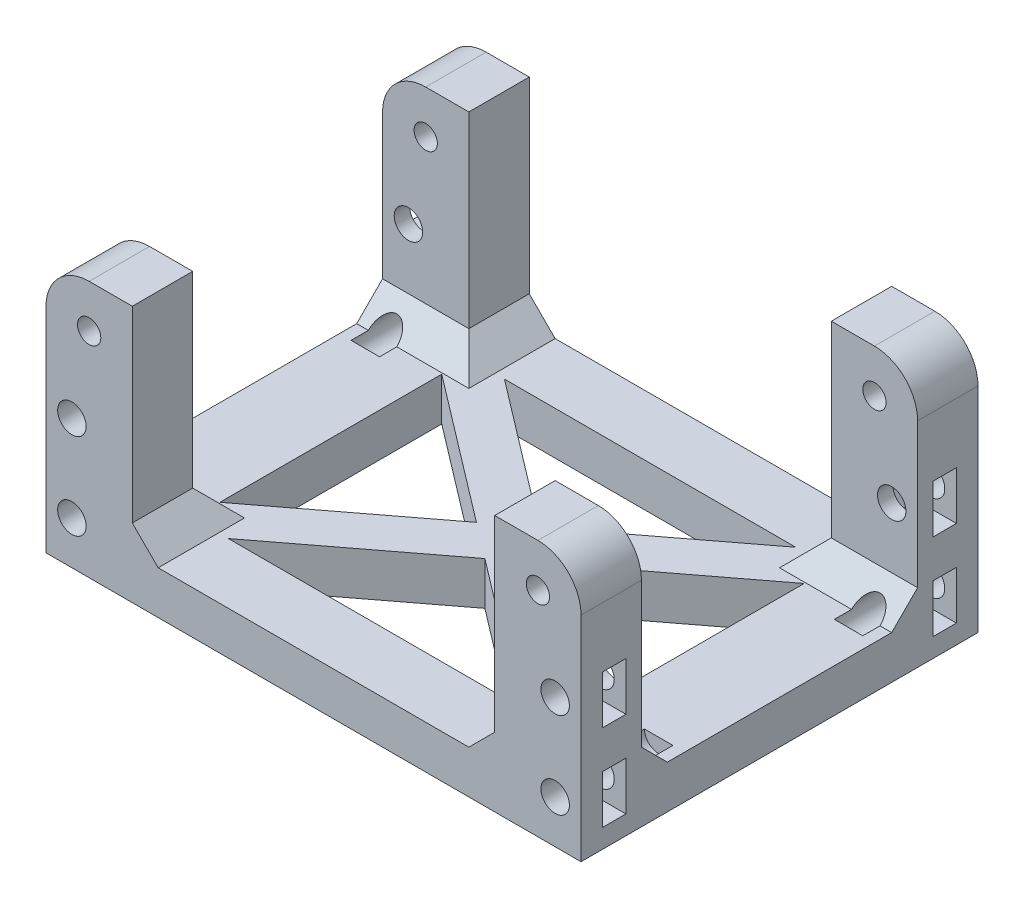
from build123d import *

# Parameters (mm, degrees)
SKETCH_1_W          = 62
SKETCH_1_H          = 46
EXTRUDE_1_DEPTH     = 5
SKETCH_2_W          = 10
SKETCH_2_H          = 15
EXTRUDE_2_DEPTH     = 7
SKETCH_3_R          = 1.65
CUT_EXTRUDE_1_DEPTH = 12
SKETCH_7_W          = 10
SKETCH_7_H          = 7
EXTRUDE_4_DEPTH     = 9.75
CUT_EXTRUDE_4_REACH = 64.945
SKETCH_8_R          = 1.35
CUT_EXTRUDE_2_DEPTH = 2.7
CUT_EXTRUDE_3_REACH = 50.735
SKETCH_5_W          = 42
SKETCH_5_H          = 32
EXTRUDE_3_DEPTH     = 5
CHAMFER_4_SIZE      = 3
FILLET_1_R          = 5


with BuildPart() as part:
    # 草图1 → 凸台-拉伸1 (new body)
    with BuildSketch(Plane(origin=(0, 0, 0), x_dir=(1, 0, 0), z_dir=(0, 1, 0))):
        Rectangle(SKETCH_1_W, SKETCH_1_H)
    extrude(amount=EXTRUDE_1_DEPTH)

    # 草图2 → 凸台-拉伸2 (add)
    with BuildSketch(Plane.XY.offset(23)):
        with Locations((-26, 12.5)):
            Rectangle(SKETCH_2_W, SKETCH_2_H)
        with Locations((26, 12.5)):
            Rectangle(SKETCH_2_W, SKETCH_2_H)
    extrude_2 = extrude(amount=-EXTRUDE_2_DEPTH)

    # 草图3 → 切除-拉伸1 (cut)
    with BuildSketch(Plane.XY.offset(23)):
        with Locations((-28, 15)):
            Circle(SKETCH_3_R)
        with Locations((-28, 5)):
            Circle(SKETCH_3_R)
        with Locations((28, 5)):
            Circle(SKETCH_3_R)
        with Locations((28, 15)):
            Circle(SKETCH_3_R)
    cut_extrude_1 = extrude(amount=-CUT_EXTRUDE_1_DEPTH, mode=Mode.SUBTRACT)

    # 草图7 → 凸台-拉伸4 (add)
    with BuildSketch(Plane(origin=(0, 20, 0), x_dir=(1, 0, 0), z_dir=(0, 1, 0))):
        with Locations((-26, -19.5)):
            Rectangle(SKETCH_7_W, SKETCH_7_H)
        with Locations((26, -19.5)):
            Rectangle(SKETCH_7_W, SKETCH_7_H)
    extrude_4 = extrude(amount=EXTRUDE_4_DEPTH)

    # 草图8 → 切除-拉伸4 (cut, up to next)
    with BuildSketch(Plane.XY.offset(23), mode=Mode.PRIVATE) as cut_extrude_4_sk1:
        with Locations((-26, 24.75)):
            Circle(SKETCH_8_R)
    cut_extrude_4_tool1 = extrude(cut_extrude_4_sk1.sketch, amount=-CUT_EXTRUDE_4_REACH, mode=Mode.PRIVATE) & part.part
    # 草图8 → 切除-拉伸4 (cut, up to next)
    with BuildSketch(Plane.XY.offset(23), mode=Mode.PRIVATE) as cut_extrude_4_sk2:
        with Locations((26, 24.75)):
            Circle(SKETCH_8_R)
    cut_extrude_4_tool2 = extrude(cut_extrude_4_sk2.sketch, amount=-CUT_EXTRUDE_4_REACH, mode=Mode.PRIVATE) & part.part
    cut_extrude_4_1 = cut_extrude_4_tool1.solids().sort_by_distance((-26, 24.75, 23))[0]
    add(cut_extrude_4_1, mode=Mode.SUBTRACT)
    cut_extrude_4_2 = cut_extrude_4_tool2.solids().sort_by_distance((26, 24.75, 23))[0]
    add(cut_extrude_4_2, mode=Mode.SUBTRACT)
    cut_extrude_4 = cut_extrude_4_1 + cut_extrude_4_2  # 切除-拉伸4 as one shape, for the pattern or mirror that repeats it

    # 草图4 → 切除-拉伸2 (cut)
    with BuildSketch(Plane.XY.offset(20.5)):
        Polygon((-29.616580754, 17.8), (-31.233161507, 17.8), (-31.233161507, 15), (-31.233161507, 12.2), (-29.616580754, 12.2), (-26.383419246, 12.2), (-24.766838493, 15), (-26.383419246, 17.8), align=None)
        Polygon((-24.766838493, 5), (-26.383419246, 7.8), (-29.616580754, 7.8), (-31.233161507, 7.8), (-31.233161507, 5), (-31.233161507, 2.2), (-29.616580754, 2.2), (-26.383419246, 2.2), align=None)
        Polygon((24.766838493, 15), (26.383419246, 12.2), (29.616580754, 12.2), (31.233161507, 12.2), (31.233161507, 15), (31.233161507, 17.8), (29.616580754, 17.8), (26.383419246, 17.8), align=None)
        Polygon((24.766838493, 5), (26.383419246, 2.2), (29.616580754, 2.2), (31.233161507, 2.2), (31.233161507, 5), (31.233161507, 7.8), (29.616580754, 7.8), (26.383419246, 7.8), align=None)
    cut_extrude_2 = extrude(amount=-CUT_EXTRUDE_2_DEPTH, mode=Mode.SUBTRACT)

    # 镜向1: 凸台-拉伸2, 切除-拉伸1, 凸台-拉伸4, 切除-拉伸4, 切除-拉伸2 across plane
    add(extrude_2.mirror(Plane.XY))
    add(cut_extrude_1.mirror(Plane.XY), mode=Mode.SUBTRACT)
    add(extrude_4.mirror(Plane.XY))
    add(cut_extrude_4.mirror(Plane.XY), mode=Mode.SUBTRACT)
    add(cut_extrude_2.mirror(Plane.XY), mode=Mode.SUBTRACT)

    # 草图5 → 切除-拉伸3 (cut, up to next)
    with BuildSketch(Plane(origin=(0, 29.75, 0), x_dir=(1, 0, 0), z_dir=(0, 1, 0)), mode=Mode.PRIVATE) as cut_extrude_3_sk1:
        Rectangle(SKETCH_5_W, SKETCH_5_H)
    cut_extrude_3_tool1 = extrude(cut_extrude_3_sk1.sketch, amount=-CUT_EXTRUDE_3_REACH, mode=Mode.PRIVATE) & part.part
    add(cut_extrude_3_tool1.solids().sort_by_distance((0, 29.75, 0))[0], mode=Mode.SUBTRACT)

    # 草图6 → 凸台-拉伸3 (add)
    with BuildSketch(Plane(origin=(0, 0, 0), x_dir=(1, 0, 0), z_dir=(0, 1, 0))):
        Polygon((-22.515108038, 14.0114207), (-4.12511837, 0), (0, 3.142947329), (-19.484891962, 17.9885793), align=None)
        Polygon((0, 3.142947329), (4.12511837, 0), (22.515108038, 14.0114207), (19.484891962, 17.9885793), align=None)
        Polygon((-4.12511837, 0), (0, -3.142947329), (4.12511837, 0), (0, 3.142947329), align=None)
        Polygon((-19.484891962, -17.9885793), (0, -3.142947329), (-4.12511837, 0), (-22.515108038, -14.0114207), align=None)
        Polygon((0, -3.142947329), (19.484891962, -17.9885793), (22.515108038, -14.0114207), (4.12511837, 0), align=None)
    extrude(amount=EXTRUDE_3_DEPTH)

    # 倒角4
    # the kernel refuses this chamfer: 3 mm, written as the material it adds along each edge
    with BuildSketch(Plane(origin=(-21, 5, 23), x_dir=(-0.02749587661058678, 0.9996219169112968, 0), z_dir=(0, 0, -1)), Plane(origin=(21, 5, 23), x_dir=(-0.9996219169112968, -0.02749587661058619, 0), z_dir=(0, 0, -1)), Plane(origin=(-21, 5, -23), x_dir=(0.9996219169112968, -0.02749587661058648, 0), z_dir=(0, 0, 1))) as chamfer_4_piece_1:
        Polygon((CHAMFER_4_SIZE * 0.999621916911, CHAMFER_4_SIZE * 0.0274958766106), (-CHAMFER_4_SIZE * 0.0274958766106, CHAMFER_4_SIZE * 0.999621916911), (0, 0), align=None)
    extrude(amount=7)
    with BuildSketch(Plane(origin=(34.065048964, 5, -16), x_dir=(0, -0.027495876610586494, 0.9996219169112968), z_dir=(-1, 0, 0))) as chamfer_4_piece_2_section:
        Polygon((CHAMFER_4_SIZE * 0.999621916911, CHAMFER_4_SIZE * 0.0274958766106), (-CHAMFER_4_SIZE * 0.0274958766106, CHAMFER_4_SIZE * 0.999621916911), (0, 0), align=None)
    chamfer_4_piece_2 = extrude(amount=13.065048964, mode=Mode.PRIVATE)
    chamfer_4_piece_2 = split(chamfer_4_piece_2, bisect_by=Plane(origin=(31, 6.10549046, -15.071672934), z_dir=(-1, 0, 0)), keep=Keep.TOP, mode=Mode.PRIVATE)
    chamfer_4_piece_2 = chamfer_4_piece_2 - Plane(origin=(28, 5, -15.071672934), x_dir=(1, 0, 0), z_dir=(0, 0, -1)) * Cylinder(1.65, 39, mode=Mode.PRIVATE)
    add(chamfer_4_piece_2)
    with BuildSketch(Plane(origin=(21, 5, -23), x_dir=(-0.9996219169112968, -0.02749587661058619, 0), z_dir=(0, 0, 1))) as chamfer_4_piece_3:
        Polygon((CHAMFER_4_SIZE * 0.999621916911, -CHAMFER_4_SIZE * 0.0274958766106), (-CHAMFER_4_SIZE * 0.0274958766106, -CHAMFER_4_SIZE * 0.999621916911), (0, 0), align=None)
    extrude(amount=7)
    with BuildSketch(Plane(origin=(-34.065048964, 5, -16), x_dir=(0, -0.027495876610586494, 0.9996219169112968), z_dir=(1, 0, 0))) as chamfer_4_piece_4_section:
        Polygon((CHAMFER_4_SIZE * 0.999621916911, -CHAMFER_4_SIZE * 0.0274958766106), (-CHAMFER_4_SIZE * 0.0274958766106, -CHAMFER_4_SIZE * 0.999621916911), (0, 0), align=None)
    chamfer_4_piece_4 = extrude(amount=13.065048964, mode=Mode.PRIVATE)
    chamfer_4_piece_4 = split(chamfer_4_piece_4, bisect_by=Plane(origin=(-31, 6.105490461, -15.071672933), z_dir=(1, 0, 0)), keep=Keep.TOP, mode=Mode.PRIVATE)
    chamfer_4_piece_4 = chamfer_4_piece_4 - Plane(origin=(-28, 5, -15.071672933), x_dir=(1, 0, 0), z_dir=(0, 0, -1)) * Cylinder(1.65, 39, mode=Mode.PRIVATE)
    add(chamfer_4_piece_4)
    with BuildSketch(Plane(origin=(-34.065048964, 5, 16), x_dir=(0, -0.027495876610586494, -0.9996219169112968), z_dir=(1, 0, 0))) as chamfer_4_piece_5_section:
        Polygon((CHAMFER_4_SIZE * 0.999621916911, CHAMFER_4_SIZE * 0.0274958766106), (-CHAMFER_4_SIZE * 0.0274958766106, CHAMFER_4_SIZE * 0.999621916911), (0, 0), align=None)
    chamfer_4_piece_5 = extrude(amount=13.065048964, mode=Mode.PRIVATE)
    chamfer_4_piece_5 = split(chamfer_4_piece_5, bisect_by=Plane(origin=(-31, 6.105490461, 15.071672933), z_dir=(1, 0, 0)), keep=Keep.TOP, mode=Mode.PRIVATE)
    chamfer_4_piece_5 = chamfer_4_piece_5 - Plane(origin=(-28, 5, 15.071672933), x_dir=(1, 0, 0), z_dir=(0, 0, 1)) * Cylinder(1.65, 39, mode=Mode.PRIVATE)
    add(chamfer_4_piece_5)
    with BuildSketch(Plane(origin=(34.065048964, 5, 16), x_dir=(0, -0.027495876610586494, -0.9996219169112968), z_dir=(-1, 0, 0))) as chamfer_4_piece_6_section:
        Polygon((CHAMFER_4_SIZE * 0.999621916911, -CHAMFER_4_SIZE * 0.0274958766106), (-CHAMFER_4_SIZE * 0.0274958766106, -CHAMFER_4_SIZE * 0.999621916911), (0, 0), align=None)
    chamfer_4_piece_6 = extrude(amount=13.065048964, mode=Mode.PRIVATE)
    chamfer_4_piece_6 = split(chamfer_4_piece_6, bisect_by=Plane(origin=(31, 6.10549046, 15.071672934), z_dir=(-1, 0, 0)), keep=Keep.TOP, mode=Mode.PRIVATE)
    chamfer_4_piece_6 = chamfer_4_piece_6 - Plane(origin=(28, 5, 15.071672934), x_dir=(1, 0, 0), z_dir=(0, 0, 1)) * Cylinder(1.65, 39, mode=Mode.PRIVATE)
    add(chamfer_4_piece_6)
    with BuildSketch(Plane(origin=(-21, 5, 23), x_dir=(-0.02749587661058678, 0.9996219169112968, 0), z_dir=(0, 0, -1))) as chamfer_4_piece_7a_section:
        Polygon((CHAMFER_4_SIZE * 0.999621916911, CHAMFER_4_SIZE * 0.0274958766106), (-CHAMFER_4_SIZE * 0.0274958766106, CHAMFER_4_SIZE * 0.999621916911), (0, 0), align=None)
    chamfer_4_piece_7a = extrude(amount=14.715048964, mode=Mode.PRIVATE)
    chamfer_4_piece_7a = split(chamfer_4_piece_7a, bisect_by=Plane(origin=(-19.8988735, 5.929641192, 16), z_dir=(0, 0, -1)), keep=Keep.TOP, mode=Mode.PRIVATE)
    chamfer_4_piece_7a = split(chamfer_4_piece_7a, bisect_by=Plane(origin=(-20.858643002, 5.929641192, 12.749352101), z_dir=(0.6060432152628566, 0, 0.7954317200324984)), keep=Keep.TOP, mode=Mode.PRIVATE)
    with BuildSketch(Plane(origin=(-34.065048964, 5, 16), x_dir=(0, -0.027495876610586494, -0.9996219169112968), z_dir=(1, 0, 0))) as chamfer_4_piece_7b_section:
        Polygon((CHAMFER_4_SIZE * 0.999621916911, CHAMFER_4_SIZE * 0.0274958766106), (-CHAMFER_4_SIZE * 0.0274958766106, CHAMFER_4_SIZE * 0.999621916911), (0, 0), align=None)
    chamfer_4_piece_7b = extrude(amount=20.780097928, mode=Mode.PRIVATE)
    chamfer_4_piece_7b = split(chamfer_4_piece_7b, bisect_by=Plane(origin=(-21, 5.915915897, 14.873215442), z_dir=(1, 0, 0)), keep=Keep.TOP, mode=Mode.PRIVATE)
    chamfer_4_piece_7b = split(chamfer_4_piece_7b, bisect_by=Plane(origin=(-17.170062576, 5.915915897, 16.224899768), z_dir=(-0.6060432152628568, 0, -0.7954317200324983)), keep=Keep.TOP, mode=Mode.PRIVATE)
    chamfer_4_piece_7 = chamfer_4_piece_7a & chamfer_4_piece_7b
    add(chamfer_4_piece_7)
    with BuildSketch(Plane(origin=(21, 5, 23), x_dir=(-0.9996219169112968, -0.02749587661058619, 0), z_dir=(0, 0, -1))) as chamfer_4_piece_8a_section:
        Polygon((CHAMFER_4_SIZE * 0.999621916911, CHAMFER_4_SIZE * 0.0274958766106), (-CHAMFER_4_SIZE * 0.0274958766106, CHAMFER_4_SIZE * 0.999621916911), (0, 0), align=None)
    chamfer_4_piece_8a = extrude(amount=14.715048964, mode=Mode.PRIVATE)
    chamfer_4_piece_8a = split(chamfer_4_piece_8a, bisect_by=Plane(origin=(20.858643002, 5.929641192, 12.749352101), z_dir=(-0.6060432152628565, 0, 0.7954317200324984)), keep=Keep.TOP, mode=Mode.PRIVATE)
    chamfer_4_piece_8a = split(chamfer_4_piece_8a, bisect_by=Plane(origin=(19.8988735, 5.929641192, 16), z_dir=(0, 0, -1)), keep=Keep.TOP, mode=Mode.PRIVATE)
    with BuildSketch(Plane(origin=(34.065048964, 5, 16), x_dir=(0, -0.027495876610586494, -0.9996219169112968), z_dir=(-1, 0, 0))) as chamfer_4_piece_8b_section:
        Polygon((CHAMFER_4_SIZE * 0.999621916911, -CHAMFER_4_SIZE * 0.0274958766106), (-CHAMFER_4_SIZE * 0.0274958766106, -CHAMFER_4_SIZE * 0.999621916911), (0, 0), align=None)
    chamfer_4_piece_8b = extrude(amount=20.780097928, mode=Mode.PRIVATE)
    chamfer_4_piece_8b = split(chamfer_4_piece_8b, bisect_by=Plane(origin=(17.170062576, 5.915915897, 16.224899768), z_dir=(0.6060432152628563, 0, -0.7954317200324986)), keep=Keep.TOP, mode=Mode.PRIVATE)
    chamfer_4_piece_8b = split(chamfer_4_piece_8b, bisect_by=Plane(origin=(21, 5.915915897, 14.873215442), z_dir=(-1, 0, 0)), keep=Keep.TOP, mode=Mode.PRIVATE)
    chamfer_4_piece_8 = chamfer_4_piece_8a & chamfer_4_piece_8b
    add(chamfer_4_piece_8)
    with BuildSketch(Plane(origin=(34.065048964, 5, -16), x_dir=(0, -0.027495876610586494, 0.9996219169112968), z_dir=(-1, 0, 0))) as chamfer_4_piece_9a_section:
        Polygon((CHAMFER_4_SIZE * 0.999621916911, CHAMFER_4_SIZE * 0.0274958766106), (-CHAMFER_4_SIZE * 0.0274958766106, CHAMFER_4_SIZE * 0.999621916911), (0, 0), align=None)
    chamfer_4_piece_9a = extrude(amount=20.780097928, mode=Mode.PRIVATE)
    chamfer_4_piece_9a = split(chamfer_4_piece_9a, bisect_by=Plane(origin=(17.170062576, 5.915915897, -16.224899768), z_dir=(0.6060432152628568, 0, 0.7954317200324984)), keep=Keep.TOP, mode=Mode.PRIVATE)
    chamfer_4_piece_9a = split(chamfer_4_piece_9a, bisect_by=Plane(origin=(21, 5.915915897, -14.873215442), z_dir=(-1, 0, 0)), keep=Keep.TOP, mode=Mode.PRIVATE)
    with BuildSketch(Plane(origin=(21, 5, -23), x_dir=(-0.9996219169112968, -0.02749587661058619, 0), z_dir=(0, 0, 1))) as chamfer_4_piece_9b_section:
        Polygon((CHAMFER_4_SIZE * 0.999621916911, -CHAMFER_4_SIZE * 0.0274958766106), (-CHAMFER_4_SIZE * 0.0274958766106, -CHAMFER_4_SIZE * 0.999621916911), (0, 0), align=None)
    chamfer_4_piece_9b = extrude(amount=14.715048964, mode=Mode.PRIVATE)
    chamfer_4_piece_9b = split(chamfer_4_piece_9b, bisect_by=Plane(origin=(20.858643002, 5.929641192, -12.749352101), z_dir=(-0.6060432152628568, 0, -0.7954317200324983)), keep=Keep.TOP, mode=Mode.PRIVATE)
    chamfer_4_piece_9b = split(chamfer_4_piece_9b, bisect_by=Plane(origin=(19.8988735, 5.929641192, -16), z_dir=(0, 0, 1)), keep=Keep.TOP, mode=Mode.PRIVATE)
    chamfer_4_piece_9 = chamfer_4_piece_9a & chamfer_4_piece_9b
    add(chamfer_4_piece_9)
    with BuildSketch(Plane(origin=(-21, 5, -23), x_dir=(0.9996219169112968, -0.02749587661058648, 0), z_dir=(0, 0, 1))) as chamfer_4_piece_10a_section:
        Polygon((CHAMFER_4_SIZE * 0.999621916911, CHAMFER_4_SIZE * 0.0274958766106), (-CHAMFER_4_SIZE * 0.0274958766106, CHAMFER_4_SIZE * 0.999621916911), (0, 0), align=None)
    chamfer_4_piece_10a = extrude(amount=14.715048964, mode=Mode.PRIVATE)
    chamfer_4_piece_10a = split(chamfer_4_piece_10a, bisect_by=Plane(origin=(-20.858643002, 5.929641192, -12.749352101), z_dir=(0.6060432152628563, 0, -0.7954317200324986)), keep=Keep.TOP, mode=Mode.PRIVATE)
    chamfer_4_piece_10a = split(chamfer_4_piece_10a, bisect_by=Plane(origin=(-19.8988735, 5.929641192, -16), z_dir=(0, 0, 1)), keep=Keep.TOP, mode=Mode.PRIVATE)
    with BuildSketch(Plane(origin=(-34.065048964, 5, -16), x_dir=(0, -0.027495876610586494, 0.9996219169112968), z_dir=(1, 0, 0))) as chamfer_4_piece_10b_section:
        Polygon((CHAMFER_4_SIZE * 0.999621916911, -CHAMFER_4_SIZE * 0.0274958766106), (-CHAMFER_4_SIZE * 0.0274958766106, -CHAMFER_4_SIZE * 0.999621916911), (0, 0), align=None)
    chamfer_4_piece_10b = extrude(amount=20.780097928, mode=Mode.PRIVATE)
    chamfer_4_piece_10b = split(chamfer_4_piece_10b, bisect_by=Plane(origin=(-17.170062576, 5.915915897, -16.224899768), z_dir=(-0.6060432152628565, 0, 0.7954317200324984)), keep=Keep.TOP, mode=Mode.PRIVATE)
    chamfer_4_piece_10b = split(chamfer_4_piece_10b, bisect_by=Plane(origin=(-21, 5.915915897, -14.873215442), z_dir=(1, 0, 0)), keep=Keep.TOP, mode=Mode.PRIVATE)
    chamfer_4_piece_10 = chamfer_4_piece_10a & chamfer_4_piece_10b
    add(chamfer_4_piece_10)

    # 圆角1
    fillet_1_edges = [part.edges().sort_by_distance(p)[0] for p in [
        (-31, 29.75, -19.5),
        (31, 29.75, -19.5),
        (-31, 29.75, 19.5),
        (31, 29.75, 19.5),
    ]]
    fillet(fillet_1_edges, radius=FILLET_1_R)


solid = part.part
